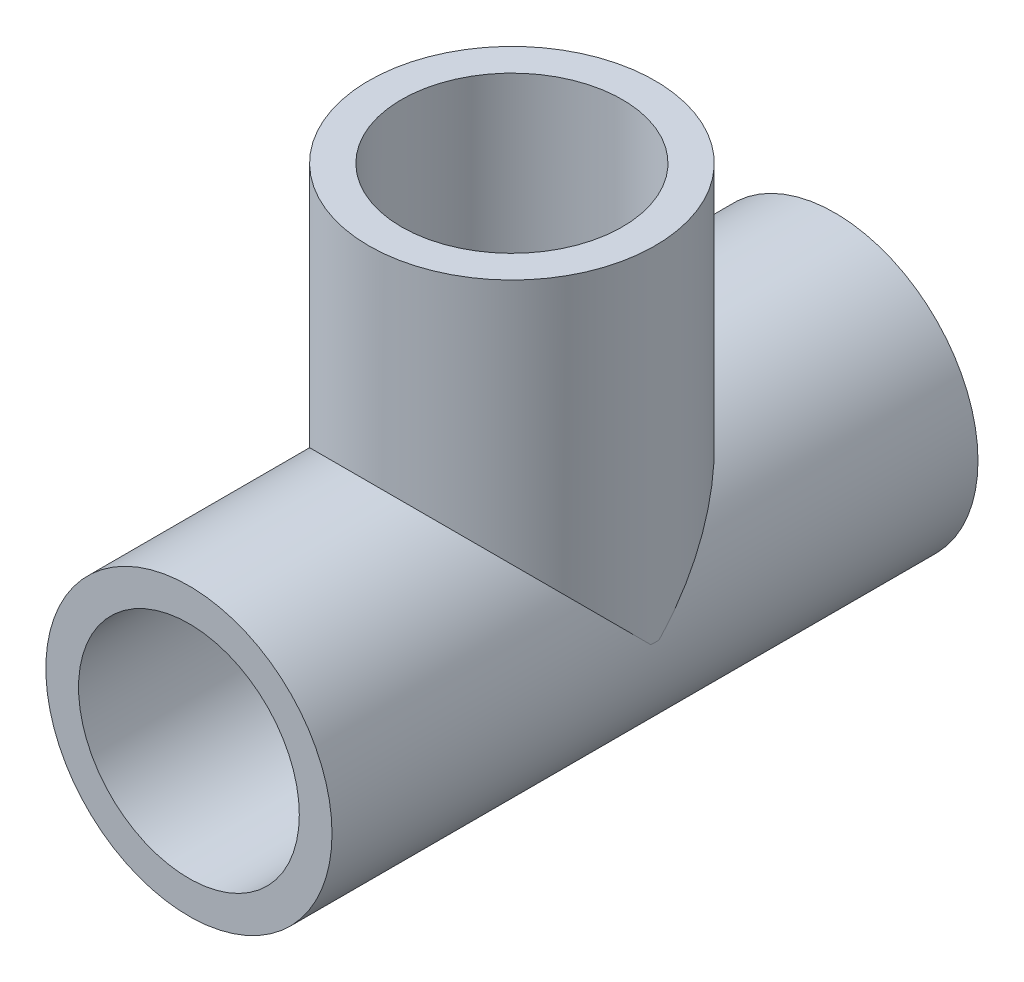
from build123d import *

# Parameters (mm, degrees)
SKETCH1_R                = 17.5
SKETCH1_R_2              = 13.5
BOSS_EXTRUDE2_DEPTH      = 25
BOSS_EXTRUDE2_DEPTH_BACK = 17
SKETCH2_R                = 17.5
SKETCH3_R                = 13.5
CUT_EXTRUDE1_DEPTH       = 92.39748364
CUT_EXTRUDE2_REACH       = 102.734
SKETCH4_R                = 13.5


with BuildPart() as part:
    # Sweep1: sweep along a curve in space
    with BuildLine() as sweep1_path:
        Line((0, 0, 0), (0, 0, -79))
    # Sketch1 → Sweep1 (sweep)
    with BuildSketch(Plane.XY):
        Circle(SKETCH1_R)
        Circle(SKETCH1_R_2, mode=Mode.SUBTRACT)
    sweep(path=sweep1_path.line)

    # Sketch2 → Boss-Extrude2 (add, two sides: drawn at the far end of the back side and taken through both)
    with BuildSketch(Plane(origin=(0, 17.5, 0), x_dir=(1, 0, 0), z_dir=(0, 1, 0)).offset(-BOSS_EXTRUDE2_DEPTH_BACK)):
        with Locations((0, 39.5)):
            Circle(SKETCH2_R)
    extrude(amount=BOSS_EXTRUDE2_DEPTH + BOSS_EXTRUDE2_DEPTH_BACK)

    # Sketch3 → Cut-Extrude1 (cut, through all)
    with BuildSketch(Plane.XY):
        Circle(SKETCH3_R)
    extrude(amount=-CUT_EXTRUDE1_DEPTH, mode=Mode.SUBTRACT)

    # Sketch4 → Cut-Extrude2 (cut, up to next)
    with BuildSketch(Plane(origin=(0, 42.5, 0), x_dir=(1, 0, 0), z_dir=(0, 1, 0)), mode=Mode.PRIVATE) as cut_extrude2_sk1:
        with Locations((0, 39.5)):
            Circle(SKETCH4_R)
    cut_extrude2_tool1 = extrude(cut_extrude2_sk1.sketch, amount=-CUT_EXTRUDE2_REACH, mode=Mode.PRIVATE) & part.part
    add(cut_extrude2_tool1.solids().sort_by_distance((0, 42.5, -39.5))[0], mode=Mode.SUBTRACT)


solid = part.part
